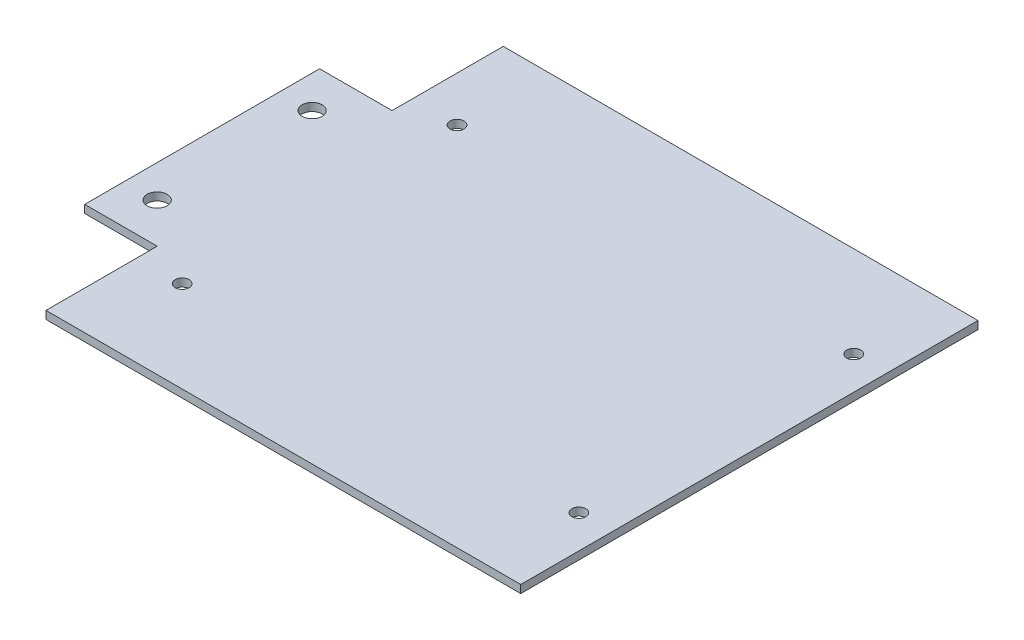
from build123d import *

# Parameters (mm, degrees)
SKETCH1_R          = 2.8
SKETCH1_R_2        = 4
BASE_FLANGE1_DEPTH = 3.17


# Sheet-metal steps are written as plain solids
with BuildPart() as part:
    # Sketch1 → Base-Flange1 (new body)
    with BuildSketch(Plane(origin=(0, 0, 0), x_dir=(1, 0, 0), z_dir=(0, 1, 0))):
        Polygon((-95, 91.5), (95, 91.5), (95, -91.5), (-95, -91.5), (-95, -47), (-124, -47), (-124, 47), (-95, 47), align=None)
        with Locations(Location((-77, 55.0037, 0), (0, 0, 270))):
            Circle(SKETCH1_R, mode=Mode.SUBTRACT)
        with Locations(Location((-77, -55.0037, 0), (0, 0, 270))):
            Circle(SKETCH1_R, mode=Mode.SUBTRACT)
        with Locations(Location((81.76, -55.0037, 0), (0, 0, 270))):
            Circle(SKETCH1_R, mode=Mode.SUBTRACT)
        with Locations(Location((81.76, 55.0037, 0), (0, 0, 270))):
            Circle(SKETCH1_R, mode=Mode.SUBTRACT)
        with Locations(Location((-111, 31, 0), (0, 0, 270))):
            Circle(SKETCH1_R_2, mode=Mode.SUBTRACT)
        with Locations(Location((-111, -31, 0), (0, 0, 270))):
            Circle(SKETCH1_R_2, mode=Mode.SUBTRACT)
    extrude(amount=-BASE_FLANGE1_DEPTH)


solid = part.part
